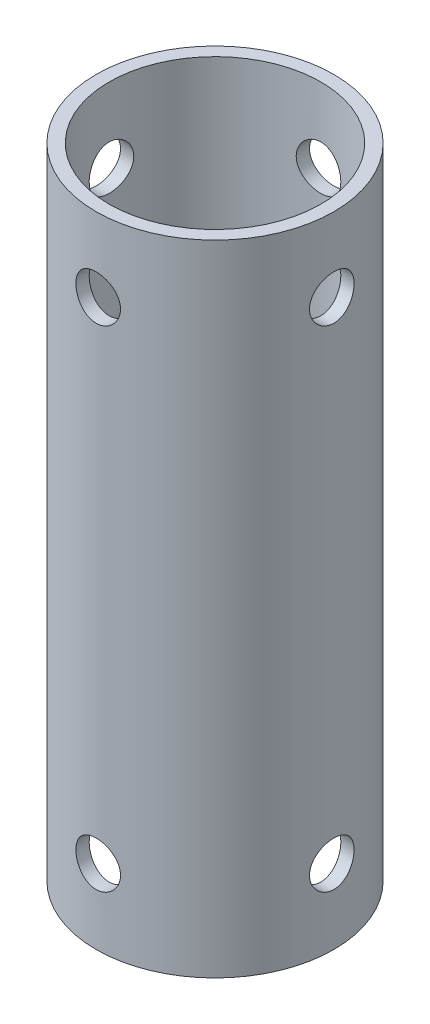
from build123d import *

# Parameters (mm, degrees)
SKETCH1_R           = 16
SKETCH1_R_2         = 14.25
BOSS_EXTRUDE1_DEPTH = 86
SKETCH2_R           = 3
CUT_EXTRUDE1_DEPTH  = 10
CIRPATTERN1_COUNT   = 4


with BuildPart() as part:
    # Sketch1 → Boss-Extrude1 (new body)
    with BuildSketch(Plane(origin=(0, 0, 0), x_dir=(1, 0, 0), z_dir=(0, 1, 0))):
        Circle(SKETCH1_R)
        Circle(SKETCH1_R_2, mode=Mode.SUBTRACT)
    extrude(amount=BOSS_EXTRUDE1_DEPTH)

    # Sketch2 → Cut-Extrude1 (cut)
    with BuildSketch(Plane(origin=(0, 0, -16), x_dir=(-1, 0, 0), z_dir=(0, 0, -1))):
        with Locations((0, 10)):
            Circle(SKETCH2_R)
        with Locations((0, 76)):
            Circle(SKETCH2_R)
    cut_extrude1 = extrude(amount=-CUT_EXTRUDE1_DEPTH, mode=Mode.SUBTRACT)

    # CirPattern1: Cut-Extrude1 ×4 about axis
    cirpattern1_axis = Axis((0, 86, 0), (0, -1, 0))
    for i in range(1, CIRPATTERN1_COUNT):
        add(cut_extrude1.rotate(cirpattern1_axis, i * 360 / CIRPATTERN1_COUNT), mode=Mode.SUBTRACT)


solid = part.part
